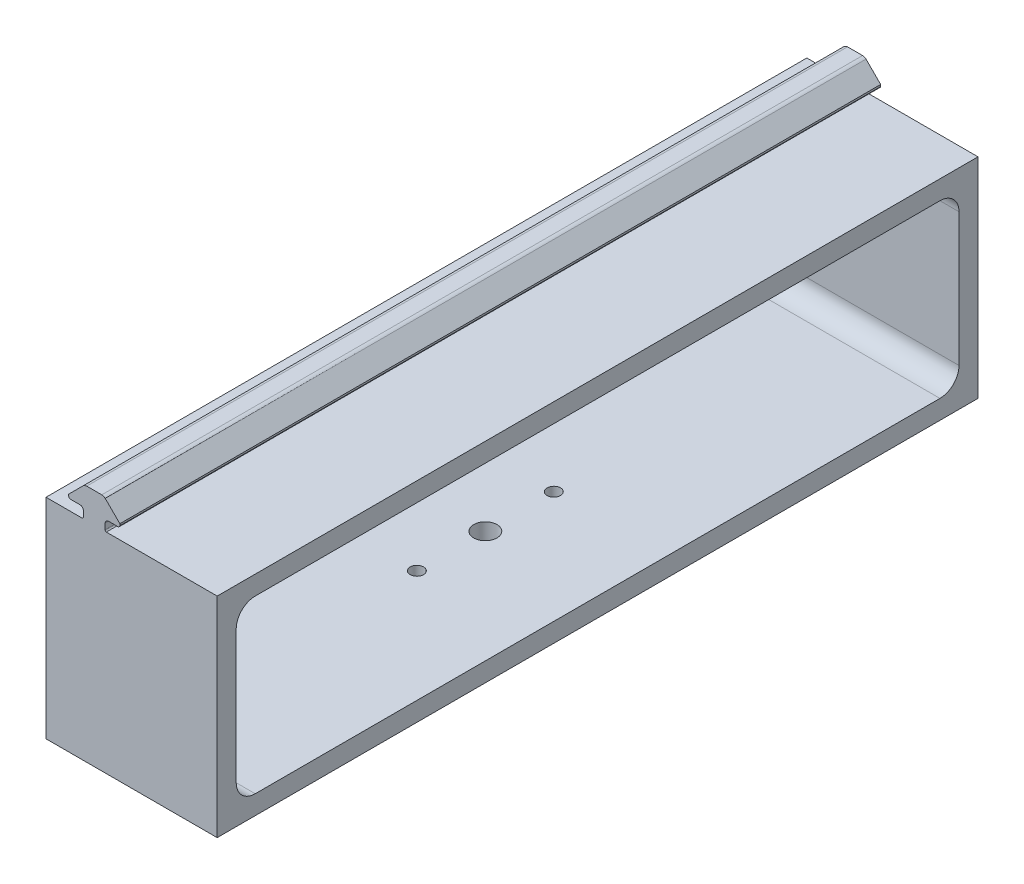
from build123d import *

# Parameters (mm, degrees)
BOSS_EXTRUDE1_DEPTH       = 200
MAIN_BODY_HOLE_DEPTH      = 208.419799276
MAIN_BODY_HOLE_DEPTH_BACK = 208.419799276
BODY_CUT_W                = 190
BODY_CUT_H                = 45
SCREW_HOLES_R             = 3.05778
SCREW_HOLES_R_2           = 1.7645
HOLE_CUTS_DEPTH           = 10
FILLET1_R                 = 5


with BuildPart() as part:
    # body sketch → Boss-Extrude1 (new body)
    with BuildSketch(Plane.XY):
        with BuildLine():
            Line((-11.792788403, 31.296564203), (-7.835417036, 31.296564203))
            ThreePointArc((-7.835417036, 31.296564203), (-7.367491329, 31.168035209), (-6.937848459, 30.94246665))
            Line((-6.937848459, 30.94246665), (-3.083381198, 27.087999388))
            Line((-3.083381198, 27.087999388), (-3.083381198, 26.62720762))
            ThreePointArc((-3.083381198, 26.62720762), (-3.247157606, 26.33019226), (-3.544172966, 26.166415852))
            Line((-3.544172966, 26.166415852), (-6.093887415, 26.166415852))
            ThreePointArc((-6.093887415, 26.166415852), (-6.684013327, 25.91258072), (-6.937848459, 25.322454808))
            Line((-6.937848459, 25.322454808), (-6.937848459, 23.771246138))
            ThreePointArc((-6.937848459, 23.771246138), (-6.853833412, 23.540250894), (-6.645828951, 23.409287254))
            Line((-6.645828951, 23.409287254), (22.5, 23.409287254))
            Line((22.5, 23.409287254), (22.5, -31.590712746))
            Line((22.5, -31.590712746), (-22.5, -31.590712746))
            Line((-22.5, -31.590712746), (-22.5, 23.409287254))
            Line((-22.5, 23.409287254), (-12.982376489, 23.409287254))
            ThreePointArc((-12.982376489, 23.409287254), (-12.774372027, 23.540250894), (-12.69035698, 23.771246138))
            Line((-12.69035698, 23.771246138), (-12.69035698, 25.322454808))
            ThreePointArc((-12.69035698, 25.322454808), (-12.944192112, 25.91258072), (-13.534318024, 26.166415852))
            Line((-13.534318024, 26.166415852), (-16.084032474, 26.166415852))
            ThreePointArc((-16.084032474, 26.166415852), (-16.381047834, 26.33019226), (-16.544824242, 26.62720762))
            Line((-16.544824242, 26.62720762), (-16.544824242, 27.087999388))
            Line((-16.544824242, 27.087999388), (-12.69035698, 30.94246665))
            ThreePointArc((-12.69035698, 30.94246665), (-12.260714111, 31.168035209), (-11.792788403, 31.296564203))
        make_face()
    extrude(amount=BOSS_EXTRUDE1_DEPTH)

    # body cut → main body hole (cut, two sides: drawn at the far end of the back side and taken through both)
    with BuildSketch(Plane(origin=(22.5, 0, 0), x_dir=(0, 0, -1), z_dir=(1, 0, 0)).offset(-MAIN_BODY_HOLE_DEPTH_BACK)):
        with Locations((-100, -4.090712746)):
            Rectangle(BODY_CUT_W, BODY_CUT_H)
    extrude(amount=MAIN_BODY_HOLE_DEPTH + MAIN_BODY_HOLE_DEPTH_BACK, mode=Mode.SUBTRACT)

    # screw holes → hole cuts (cut)
    with BuildSketch(Plane(origin=(0, -31.590712746, 0), x_dir=(-1, 0, 0), z_dir=(0, -1, 0))):
        with Locations((7.01, -100)):
            Circle(SCREW_HOLES_R)
        with Locations((7.01, -81.999941546)):
            Circle(SCREW_HOLES_R_2)
        with Locations((7.01, -117.999941546)):
            Circle(SCREW_HOLES_R_2)
    extrude(amount=-HOLE_CUTS_DEPTH, mode=Mode.SUBTRACT)

    # Fillet1
    fillet1_edges = [part.edges().sort_by_distance(p)[0] for p in [
        (0, -26.590712746, 195),
        (0, 18.409287254, 195),
        (0, 18.409287254, 5),
        (0, -26.590712746, 5),
    ]]
    fillet(fillet1_edges, radius=FILLET1_R)


solid = part.part
